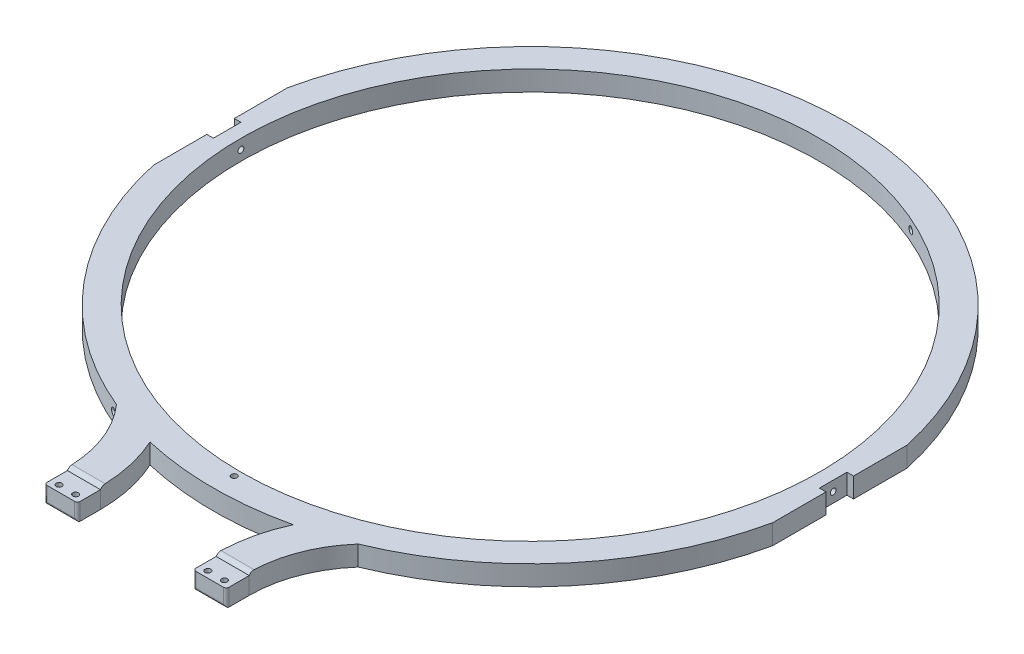
from build123d import *

# Parameters (mm, degrees)
SKETCH2_R               = 105
BOSS_EXTRUDE1_DEPTH     = 3.625
CUT_EXTRUDE1_DEPTH      = 184.813392126
CUT_EXTRUDE1_DEPTH_BACK = 184.813392126
SKETCH4_R               = 1.25
SKETCH7_R               = 1.05
CUT_EXTRUDE2_DEPTH      = 184.920594346
CUT_EXTRUDE3_DEPTH      = 184.813392191
CUT_EXTRUDE3_DEPTH_BACK = 184.813392191
SKETCH9_R               = 1.05
CUT_EXTRUDE4_DEPTH      = 184.813392192
CUT_EXTRUDE4_DEPTH_BACK = 184.813392192
SKETCH10_W              = 20
SKETCH10_H              = 10
CUT_EXTRUDE5_DEPTH      = 184.745375857
CUT_EXTRUDE5_DEPTH_BACK = 184.745375857
SKETCH11_W              = 30
SKETCH11_H              = 90
SKETCH12_R              = 1.05
CUT_EXTRUDE6_DEPTH      = 7.25
FILLET1_R               = 1
SKETCH13_W              = 130
SKETCH13_H              = 10
CUT_EXTRUDE7_DEPTH      = 1
FILLET2_R               = 2


with BuildPart() as part:
    # Sketch2 → Boss-Extrude1 (new, symmetric)
    with BuildSketch(Plane(origin=(0, 0, 0), x_dir=(1, 0, 0), z_dir=(0, 1, 0))):
        with BuildLine():
            Line((-33, -135), (-33, -143.35))
            Line((-33, -143.35), (-21, -143.35))
            Line((-21, -143.35), (-21, -135))
            ThreePointArc((-21, -135), (-22.264456843, -123.242302365), (-26, -112.022319205))
            ThreePointArc((-26, -112.022319205), (0, -115), (26, -112.022319205))
            ThreePointArc((26, -112.022319205), (22.264456843, -123.242302365), (21, -135))
            Line((21, -135), (21, -143.35))
            Line((21, -143.35), (33, -143.35))
            Line((33, -143.35), (33, -135))
            ThreePointArc((33, -135), (35.810957179, -119.65357728), (43.878842197, -106.299798718))
            ThreePointArc((43.878842197, -106.299798718), (0, 115), (-43.878842197, -106.299798718))
            ThreePointArc((-43.878842197, -106.299798718), (-35.810957179, -119.65357728), (-33, -135))
        make_face()
        with Locations(Location((0, 0, 0), (0, 0, 90))):
            Circle(SKETCH2_R, mode=Mode.SUBTRACT)
    extrude(amount=BOSS_EXTRUDE1_DEPTH, both=True)

    # Sketch4 → Cut-Extrude1 (cut, two sides: drawn at the far end of the back side and taken through both)
    with BuildSketch(Plane(origin=(0, 0, 0), x_dir=(0, 1, 0), z_dir=(0.39874906892524387, 0, -0.9170600743851252)).offset(-CUT_EXTRUDE1_DEPTH_BACK)):
        with Locations(Location((0, 0, 0), (0, 0, 270))):
            Circle(SKETCH4_R)
    extrude(amount=CUT_EXTRUDE1_DEPTH + CUT_EXTRUDE1_DEPTH_BACK, mode=Mode.SUBTRACT)

    # Sketch7 → Cut-Extrude2 (cut, through all)
    with BuildSketch(Plane(origin=(0, 3.625, 0), x_dir=(1, 0, 0), z_dir=(0, 1, 0))):
        with Locations(Location((-30, -141, 0), (0, 0, 270))):
            Circle(SKETCH7_R)
        with Locations(Location((-24, -141, 0), (0, 0, 270))):
            Circle(SKETCH7_R)
        with Locations(Location((24, -141, 0), (0, 0, 270))):
            Circle(SKETCH7_R)
        with Locations(Location((30, -141, 0), (0, 0, 270))):
            Circle(SKETCH7_R)
    extrude(amount=-CUT_EXTRUDE2_DEPTH, mode=Mode.SUBTRACT)

    # Sketch9 → Cut-Extrude3 (cut, two sides: drawn at the far end of the back side and taken through both)
    with BuildSketch(Plane(origin=(0, 0, 0), x_dir=(0, 0, -1), z_dir=(1, 0, 0)).offset(-CUT_EXTRUDE3_DEPTH_BACK)):
        with Locations(Location((0, 0, 0), (0, 0, 180))):
            Circle(SKETCH9_R)
    extrude(amount=CUT_EXTRUDE3_DEPTH + CUT_EXTRUDE3_DEPTH_BACK, mode=Mode.SUBTRACT)

    # Sketch10 → Cut-Extrude4 (cut, two sides: drawn at the far end of the back side and taken through both)
    with BuildSketch(Plane(origin=(0, 0, 0), x_dir=(1, 0, 0), z_dir=(0, 1, 0)).offset(-CUT_EXTRUDE4_DEPTH_BACK)):
        with Locations((-120, 0)):
            Rectangle(SKETCH10_W, SKETCH10_H)
        with Locations((120, 0)):
            Rectangle(SKETCH10_W, SKETCH10_H)
    extrude(amount=CUT_EXTRUDE4_DEPTH + CUT_EXTRUDE4_DEPTH_BACK, mode=Mode.SUBTRACT)

    # Sketch11 → Cut-Extrude5 (cut, two sides: drawn at the far end of the back side and taken through both)
    with BuildSketch(Plane(origin=(0, 0, 0), x_dir=(1, 0, 0), z_dir=(0, 1, 0)).offset(-CUT_EXTRUDE5_DEPTH_BACK)):
        with Locations((-127.391252931, 0)):
            Rectangle(SKETCH11_W, SKETCH11_H)
        with Locations((127.391252931, 0)):
            Rectangle(SKETCH11_W, SKETCH11_H)
    extrude(amount=CUT_EXTRUDE5_DEPTH + CUT_EXTRUDE5_DEPTH_BACK, mode=Mode.SUBTRACT)

    # Sketch12 → Cut-Extrude6 (cut)
    with BuildSketch(Plane(origin=(0, 3.625, 0), x_dir=(1, 0, 0), z_dir=(0, 1, 0))):
        with Locations(Location((0, -107.45, 0), (0, 0, 270))):
            Circle(SKETCH12_R)
    extrude(amount=-CUT_EXTRUDE6_DEPTH, mode=Mode.SUBTRACT)

    # Fillet1
    fillet1_edges = [part.edges().sort_by_distance(p)[0] for p in [
        (-27, -3.625, 143.35),
        (27, -3.625, 143.35),
        (-21, 0, 143.35),
        (-33, 0, 143.35),
        (27, 3.625, 143.35),
        (33, 0, 143.35),
        (21, 0, 143.35),
        (-27, 3.625, 143.35),
    ]]
    fillet(fillet1_edges, radius=FILLET1_R)

    # Sketch13 → Cut-Extrude7 (cut)
    with BuildSketch(Plane(origin=(0, 3.625, 0), x_dir=(1, 0, 0), z_dir=(0, 1, 0))):
        with Locations((0, -140)):
            Rectangle(SKETCH13_W, SKETCH13_H)
    extrude(amount=-CUT_EXTRUDE7_DEPTH, mode=Mode.SUBTRACT)

    # Fillet2
    # the kernel refuses this fillet: 2 mm, written as the material it takes off along each edge
    with BuildSketch(Plane(origin=(37.330127019, 3.625, 135), x_dir=(0, 0, -1), z_dir=(-1, 0, 0))) as fillet2_piece_1:
        with BuildLine():
            CenterArc((1.732050808, 2), FILLET2_R, 210, 60)
            Line((0, 1), (-0.034641016, 0.98))
            ThreePointArc((-0.034641016, 0.98), (-0.04, 0.5), (-0.04, 0))
            Line((-0.04, 0), (0, -0.04))
            Line((0, -0.04), (1.732050808, -0.04))
            Line((1.732050808, -0.04), (1.732050808, 0))
        make_face()
    extrude(amount=20.660254038, mode=Mode.SUBTRACT)
    with BuildSketch(Plane(origin=(-16.669872981, 3.625, 135), x_dir=(0, -1, 0), z_dir=(-1, 0, 0))) as fillet2_piece_2:
        with BuildLine():
            CenterArc((2, -1.732050808), FILLET2_R, 120, 60)
            Line((0, -1.732050808), (-0.04, -1.732050808))
            Line((-0.04, -1.732050808), (-0.04, 0))
            Line((-0.04, 0), (0, 0.04))
            ThreePointArc((0, 0.04), (0.5, 0.04), (0.98, 0.034641016))
            Line((0.98, 0.034641016), (1, 0))
        make_face()
    extrude(amount=20.660254038, mode=Mode.SUBTRACT)


solid = part.part
